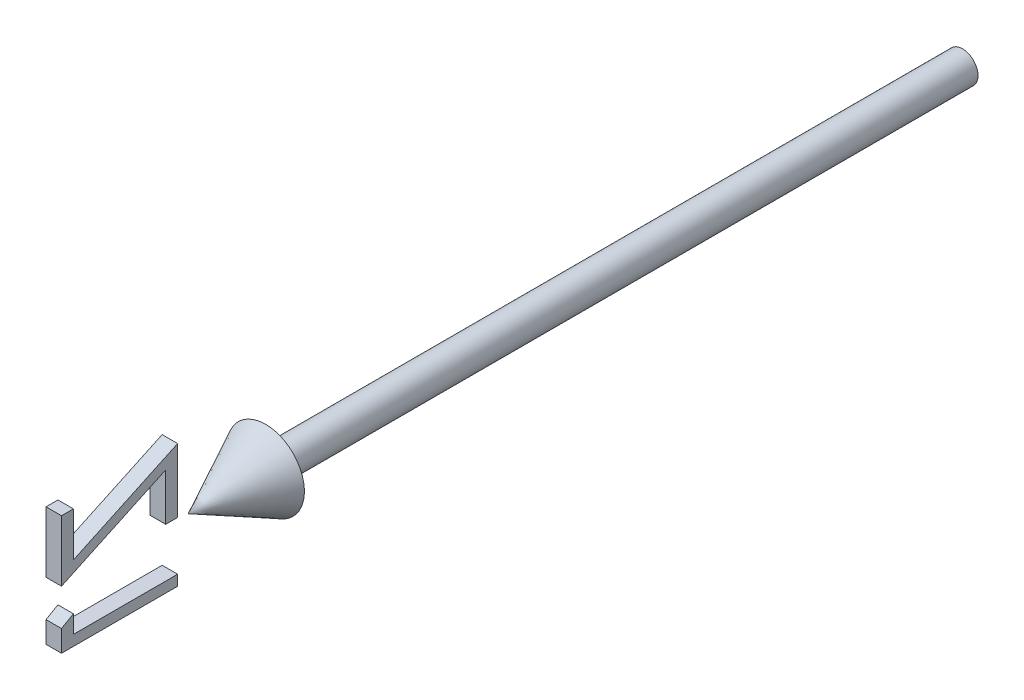
from build123d import *

# Parameters (mm, degrees)
BOSS_EXTRUDE1_DEPTH        = 1
BOSS_EXTRUDE1_DEPTH_BACK   = 1
BOSS_EXTRUDE1_2_DEPTH      = 1
BOSS_EXTRUDE1_2_DEPTH_BACK = 1


with BuildPart() as part:
    # Sketch2 → Revolve1 (revolve)
    with BuildSketch(Plane(origin=(0, 0, 0), x_dir=(1, 0, 0), z_dir=(0, 1, 0))):
        Polygon((0, -100), (5, -90), (2, -90), (2, 0), (0, 0), align=None)
    revolve(axis=Axis((0, 0, -41.949952025), (0, 0, 1)))


with BuildPart() as body_2:
    # Sketch3 → Boss-Extrude1 (new, two sides: drawn at the far end of the back side and taken through both)
    with BuildSketch(Plane(origin=(0, 0, 0), x_dir=(0, -1, 0), z_dir=(1, 0, 0)).offset(-BOSS_EXTRUDE1_DEPTH_BACK)):
        Polygon((-8.958586521, -115.829050545), (-8.958586521, -117.367512083), (-1.073971137, -117.367512083), (-7.366038444, -103.905973622), (-1.266278829, -103.905973622), (-1.266278829, -102.367512083), (-9.535509598, -102.367512083), (-3.243442291, -115.829050545), align=None)
    extrude(amount=BOSS_EXTRUDE1_DEPTH + BOSS_EXTRUDE1_DEPTH_BACK)


with BuildPart() as body_3:
    # Sketch3 → Boss-Extrude1 2 (new, two sides: drawn at the far end of the back side and taken through both)
    with BuildSketch(Plane(origin=(0, 0, 0), x_dir=(0, -1, 0), z_dir=(1, 0, 0)).offset(-BOSS_EXTRUDE1_2_DEPTH_BACK)):
        Polygon((3.652591363, -117.367512083), (6.426028863, -117.367512083), (6.426028863, -102.367512083), (5.079875017, -102.367512083), (5.079875017, -115.829050545), (2.772182709, -115.829050545), align=None)
    extrude(amount=BOSS_EXTRUDE1_2_DEPTH + BOSS_EXTRUDE1_2_DEPTH_BACK)


solid = Compound([part.part, body_2.part, body_3.part])
